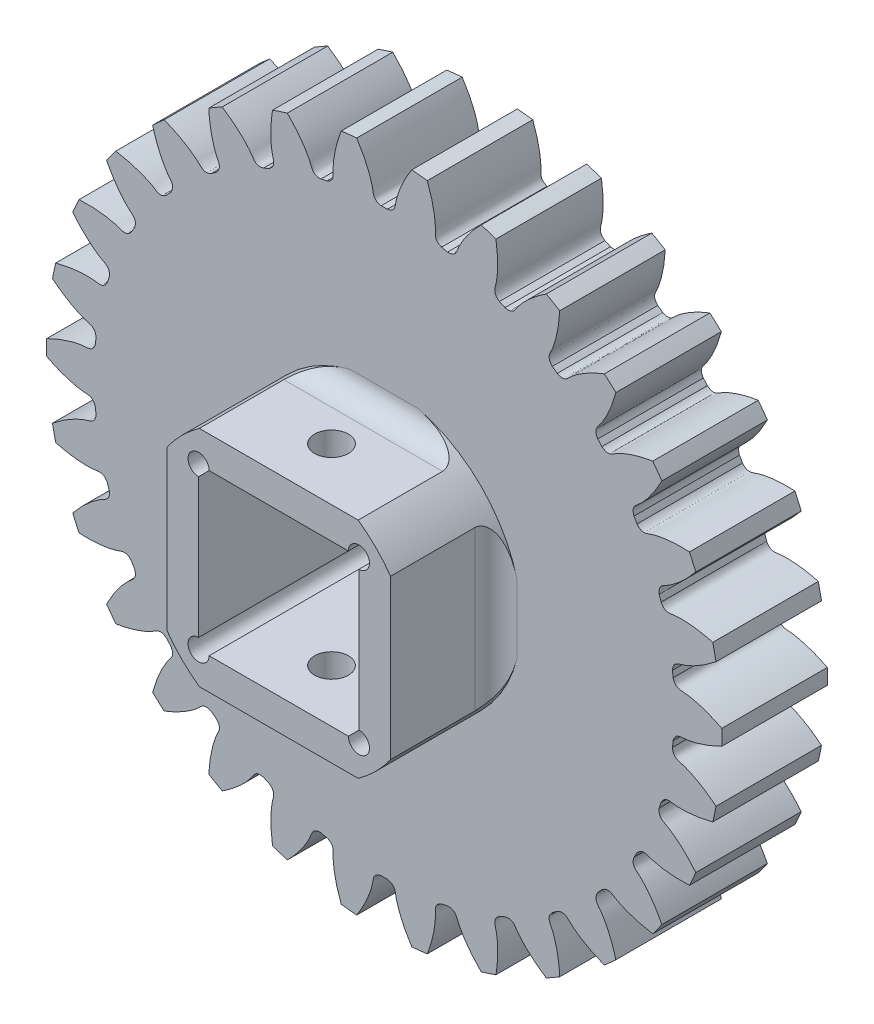
from build123d import *

# Parameters (mm, degrees)
SKETCH_1_R               = 32
EXTRUDE_1_DEPTH          = 10
CUT_EXTRUDE_1_DEPTH      = 47.346520905
PATTERN_CIRCULAR_1_COUNT = 30
SKETCH_4_W               = 15.2
SKETCH_4_H               = 15.2
EXTRUDE_2_DEPTH          = 10
SKETCH_5_R               = 1.6
CUT_EXTRUDE_2_DEPTH      = 57.830249645
SKETCH_6_W               = 15.2
SKETCH_6_H               = 15.2
CUT_EXTRUDE_3_DEPTH      = 47.272887678
SKETCH_7_R               = 1
CUT_EXTRUDE_4_DEPTH      = 50.408300275
EXTRUDE_START            = 6.5
EXTRUDE_3_DEPTH          = 6.5
FILLET_1_R               = 2


with BuildPart() as part:
    # 草图1 → 凸台-拉伸1 (new body)
    with BuildSketch(Plane.XY):
        Circle(SKETCH_1_R)
    extrude(amount=EXTRUDE_1_DEPTH)

    # 草图2 → 切除-拉伸1 (cut, through all)
    with BuildSketch(Plane.XY):
        with BuildLine():
            ThreePointArc((0.291117258, 27.498459061), (0, 27.5), (-0.291117258, 27.498459061))
            add(Edge.make_bspline(
                [(-0.291117258, 27.498459061), (-1.016461379, 27.62595034), (-1.020609493, 28.094265272), (-1.11796964, 28.57715803), (-1.139901483, 28.676258475), (-1.166494173, 28.785849819), (-1.198135434, 28.905795984), (-1.235261247, 29.035929815), (-1.278286716, 29.176077028), (-1.327627025, 29.326048954), (-1.383690587, 29.485644922), (-1.446880683, 29.65465171), (-1.517594534, 29.8328439), (-1.596223153, 30.019983966), (-1.683150964, 30.215822454), (-1.778755503, 30.42009815), (-1.883407094, 30.632538255), (-1.99746854, 30.852858572), (-2.121294814, 31.0807637), (-2.255232758, 31.315947232), (-2.399620786, 31.558091968), (-2.554788592, 31.806870128), (-2.721056861, 32.061943577), (-2.89873699, 32.322964055), (-3.088130814, 32.589573415), (-3.289530328, 32.861403867), (-3.503217435, 33.138078232), (-3.729463678, 33.419210196), (-3.968529992, 33.70440458), (-4.220666464, 33.993257607), (-4.486112085, 34.285357181), (-4.765094529, 34.580283169), (-5.057829915, 34.877607694), (-5.364522622, 35.176895427), (-5.685364966, 35.47770389), (-6.137847732, 35.885241657), (-6.490689237, 36.184143062), (-6.732623663, 36.381116246)],
                knots=[0, 0, 0, 0, 0.115323882, 0.12341257, 0.132512303, 0.142623081, 0.153744905, 0.165877774, 0.179021689, 0.193176649, 0.208342655, 0.224519706, 0.241707802, 0.259906945, 0.279117132, 0.299338365, 0.320570644, 0.342813968, 0.366068337, 0.390333752, 0.415610213, 0.441897719, 0.46919627, 0.497505867, 0.52682651, 0.557158198, 0.588500931, 0.62085471, 0.654219534, 0.688595404, 0.723982319, 0.76038028, 0.797789286, 0.836209338, 0.875640435, 0.916082578, 1, 1, 1, 1], degree=3))
            ThreePointArc((-6.732623663, 36.381116246), (0, 36.998835667), (6.732623663, 36.381116246))
            add(Edge.make_bspline(
                [(0.291117258, 27.498459061), (1.016461379, 27.62595034), (1.020609493, 28.094265272), (1.11796964, 28.57715803), (1.139901483, 28.676258475), (1.166494173, 28.785849819), (1.198135434, 28.905795984), (1.235261247, 29.035929815), (1.278286716, 29.176077028), (1.327627025, 29.326048954), (1.383690587, 29.485644922), (1.446880683, 29.65465171), (1.517594534, 29.8328439), (1.596223153, 30.019983966), (1.683150964, 30.215822454), (1.778755503, 30.42009815), (1.883407094, 30.632538255), (1.99746854, 30.852858572), (2.121294814, 31.0807637), (2.255232758, 31.315947232), (2.399620786, 31.558091968), (2.554788592, 31.806870128), (2.721056861, 32.061943577), (2.89873699, 32.322964055), (3.088130814, 32.589573415), (3.289530328, 32.861403867), (3.503217435, 33.138078232), (3.729463678, 33.419210196), (3.968529992, 33.70440458), (4.220666464, 33.993257607), (4.486112085, 34.285357181), (4.765094529, 34.580283169), (5.057829915, 34.877607694), (5.364522622, 35.176895427), (5.685364966, 35.47770389), (6.137847732, 35.885241657), (6.490689237, 36.184143062), (6.732623663, 36.381116246)],
                knots=[0, 0, 0, 0, 0.115323882, 0.12341257, 0.132512303, 0.142623081, 0.153744905, 0.165877774, 0.179021689, 0.193176649, 0.208342655, 0.224519706, 0.241707802, 0.259906945, 0.279117132, 0.299338365, 0.320570644, 0.342813968, 0.366068337, 0.390333752, 0.415610213, 0.441897719, 0.46919627, 0.497505867, 0.52682651, 0.557158198, 0.588500931, 0.62085471, 0.654219534, 0.688595404, 0.723982319, 0.76038028, 0.797789286, 0.836209338, 0.875640435, 0.916082578, 1, 1, 1, 1], degree=3))
        make_face()
    cut_extrude_1 = extrude(amount=CUT_EXTRUDE_1_DEPTH, mode=Mode.SUBTRACT)

    # 阵列(圆周)1: 切除-拉伸1 ×30 about axis
    pattern_circular_1_axis = Axis((0, 0, -35.2), (0, 0, 1))
    for i in range(1, PATTERN_CIRCULAR_1_COUNT):
        add(cut_extrude_1.rotate(pattern_circular_1_axis, i * 360 / PATTERN_CIRCULAR_1_COUNT), mode=Mode.SUBTRACT)

    # 草图4 → 凸台-拉伸2 (add)
    with BuildSketch(Plane.XY.offset(10)):
        with BuildLine():
            Line((-10.6, -7.525955089), (-10.6, 7.525955089))
            ThreePointArc((-10.6, 7.525955089), (-9.192388155, 9.192388155), (-7.525955089, 10.6))
            Line((-7.525955089, 10.6), (7.525955089, 10.6))
            ThreePointArc((7.525955089, 10.6), (9.192388155, 9.192388155), (10.6, 7.525955089))
            Line((10.6, 7.525955089), (10.6, -7.525955089))
            ThreePointArc((10.6, -7.525955089), (9.192388155, -9.192388155), (7.525955089, -10.6))
            Line((7.525955089, -10.6), (-7.525955089, -10.6))
            ThreePointArc((-7.525955089, -10.6), (-9.192388155, -9.192388155), (-10.6, -7.525955089))
        make_face()
        Rectangle(SKETCH_4_W, SKETCH_4_H, mode=Mode.SUBTRACT)
    extrude(amount=EXTRUDE_2_DEPTH)

    # 草图5 → 切除-拉伸2 (cut, through all)
    with BuildSketch(Plane(origin=(0, 10.6, 0), x_dir=(1, 0, 0), z_dir=(0, 1, 0))):
        with Locations((0, -15)):
            Circle(SKETCH_5_R)
    extrude(amount=-CUT_EXTRUDE_2_DEPTH, mode=Mode.SUBTRACT)

    # 草图6 → 切除-拉伸3 (cut, through all)
    with BuildSketch(Plane.XY.offset(10)):
        Rectangle(SKETCH_6_W, SKETCH_6_H)
    extrude(amount=-CUT_EXTRUDE_3_DEPTH, mode=Mode.SUBTRACT)

    # 草图7 → 切除-拉伸4 (cut, through all)
    with BuildSketch(Plane.XY.offset(20)):
        with Locations((7.6, 7.6)):
            Circle(SKETCH_7_R)
        with Locations((7.6, -7.6)):
            Circle(SKETCH_7_R)
        with Locations((-7.6, -7.6)):
            Circle(SKETCH_7_R)
        with Locations((-7.6, 7.6)):
            Circle(SKETCH_7_R)
    extrude(amount=-CUT_EXTRUDE_4_DEPTH, mode=Mode.SUBTRACT)

    # 草图9 → 凸台-拉伸3 (add)
    with BuildSketch(Plane(origin=(0, 0, 0), x_dir=(-1, 0, 0), z_dir=(0, 0, -1)).offset(EXTRUDE_START)):
        with BuildLine():
            Line((7.525955089, 10.6), (-7.525955089, 10.6))
            ThreePointArc((-7.525955089, 10.6), (-9.192388155, 9.192388155), (-10.6, 7.525955089))
            Line((-10.6, 7.525955089), (-10.6, -7.525955089))
            ThreePointArc((-10.6, -7.525955089), (-9.192388155, -9.192388155), (-7.525955089, -10.6))
            Line((-7.525955089, -10.6), (7.525955089, -10.6))
            ThreePointArc((7.525955089, -10.6), (9.192388155, -9.192388155), (10.6, -7.525955089))
            Line((10.6, -7.525955089), (10.6, 7.525955089))
            ThreePointArc((10.6, 7.525955089), (9.192388155, 9.192388155), (7.525955089, 10.6))
        make_face()
        with BuildLine():
            Line((6.6, -7.6), (-6.6, -7.6))
            ThreePointArc((-6.6, -7.6), (-8.307106781, -8.307106781), (-7.6, -6.6))
            Line((-7.6, -6.6), (-7.6, 6.6))
            ThreePointArc((-7.6, 6.6), (-8.307106781, 8.307106781), (-6.6, 7.6))
            Line((-6.6, 7.6), (6.6, 7.6))
            ThreePointArc((6.6, 7.6), (8.307106781, 8.307106781), (7.6, 6.6))
            Line((7.6, 6.6), (7.6, -6.6))
            ThreePointArc((7.6, -6.6), (8.307106781, -8.307106781), (6.6, -7.6))
        make_face(mode=Mode.SUBTRACT)
    extrude(amount=-EXTRUDE_3_DEPTH)

    # 圆角1
    fillet_1_edges = [part.edges().sort_by_distance(p)[0] for p in [
        (-10.6, 0, 10),
        (0, 10.6, 10),
        (10.6, 0, 10),
        (0, -10.6, 10),
        (10.6, 0, 0),
        (0, -10.6, 0),
        (0, 10.6, 0),
        (-10.6, 0, 0),
    ]]
    fillet(fillet_1_edges, radius=FILLET_1_R)


solid = part.part
